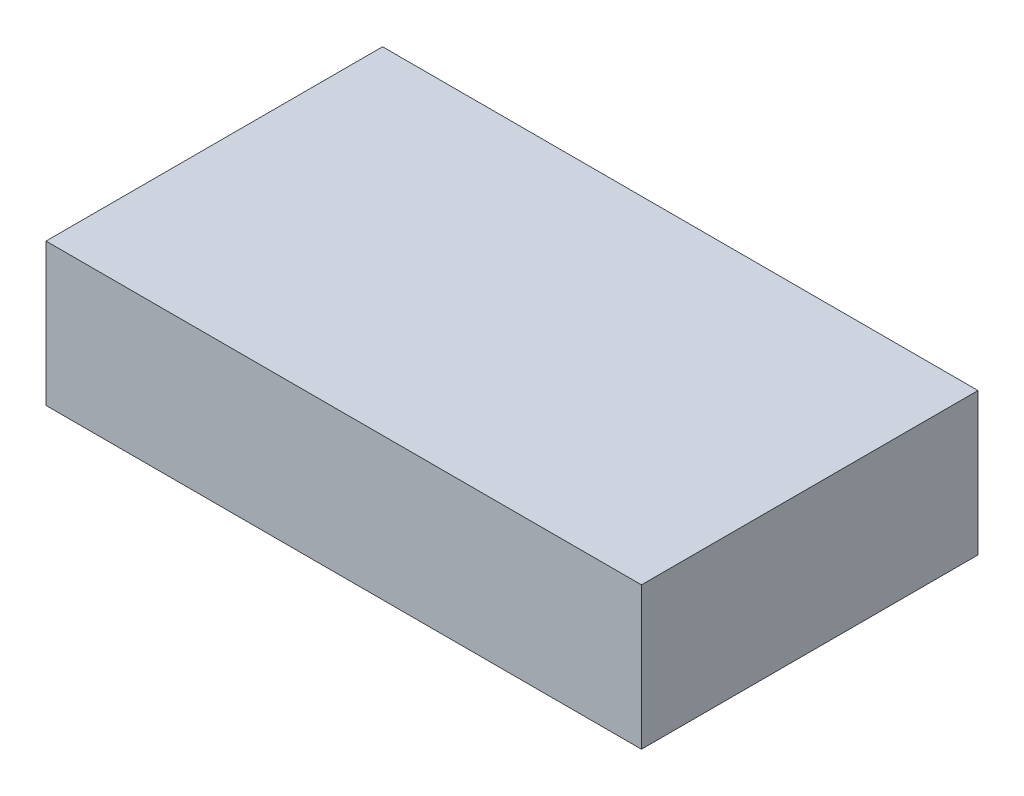
from build123d import *

# Parameters (mm, degrees)
SKETCH1_W           = 46
SKETCH1_H           = 26
BOSS_EXTRUDE1_DEPTH = 11


with BuildPart() as part:
    # Sketch1 → Boss-Extrude1 (new body)
    with BuildSketch(Plane(origin=(0, 0, 0), x_dir=(1, 0, 0), z_dir=(0, 1, 0))):
        Rectangle(SKETCH1_W, SKETCH1_H)
    extrude(amount=BOSS_EXTRUDE1_DEPTH)


solid = part.part
